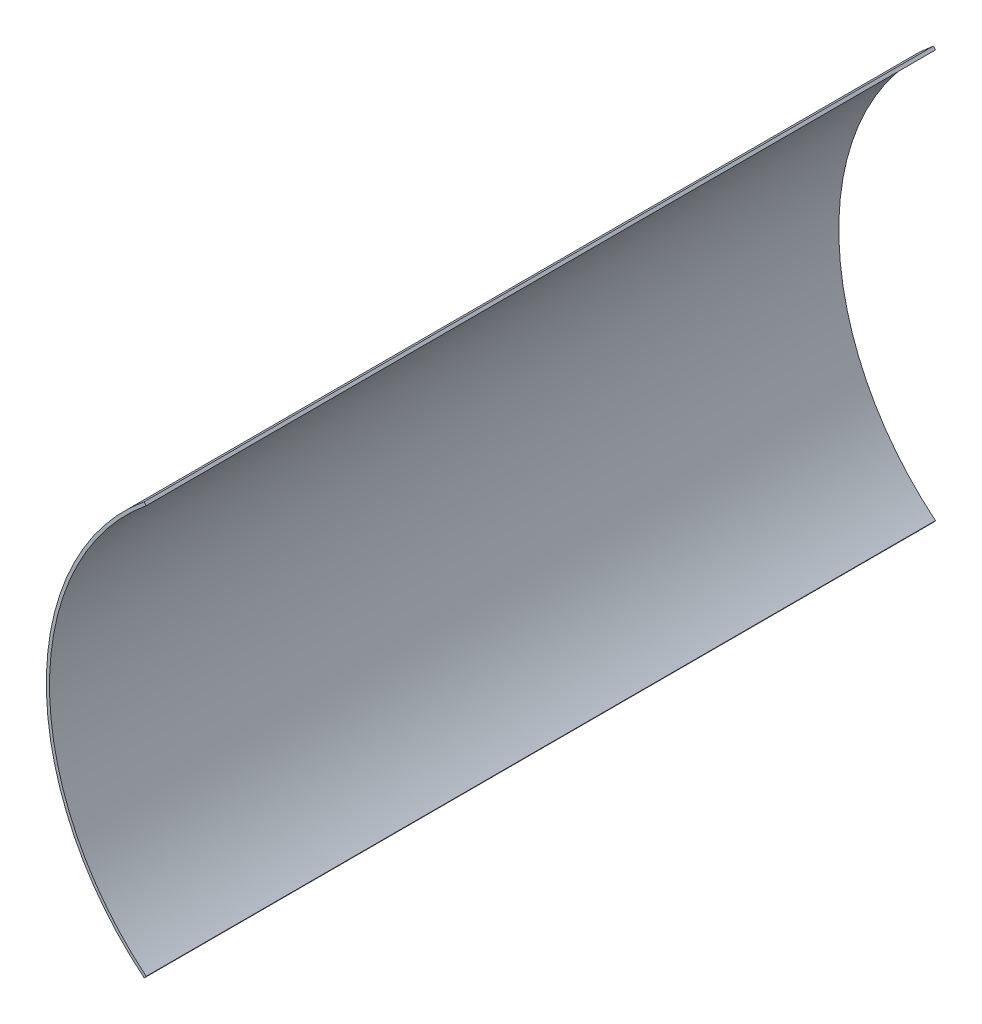
from build123d import *

# Parameters (mm, degrees)
FLANGE_BASE1_DEPTH = 750


# Sheet-metal steps are written as plain solids
with BuildPart() as part:
    # Esboço1 → Flange-base1 (new body)
    with BuildSketch(Plane.XY):
        with BuildLine():
            ThreePointArc((-158.113883008, 443.64916731), (-250, 250), (-158.113883008, 56.35083269))
            Line((-158.113883008, 56.35083269), (-160.011249605, 54.027042682))
            ThreePointArc((-160.011249605, 54.027042682), (-253, 250), (-160.011249605, 445.972957318))
            Line((-160.011249605, 445.972957318), (-158.113883008, 443.64916731))
        make_face()
    extrude(amount=FLANGE_BASE1_DEPTH)


solid = part.part
